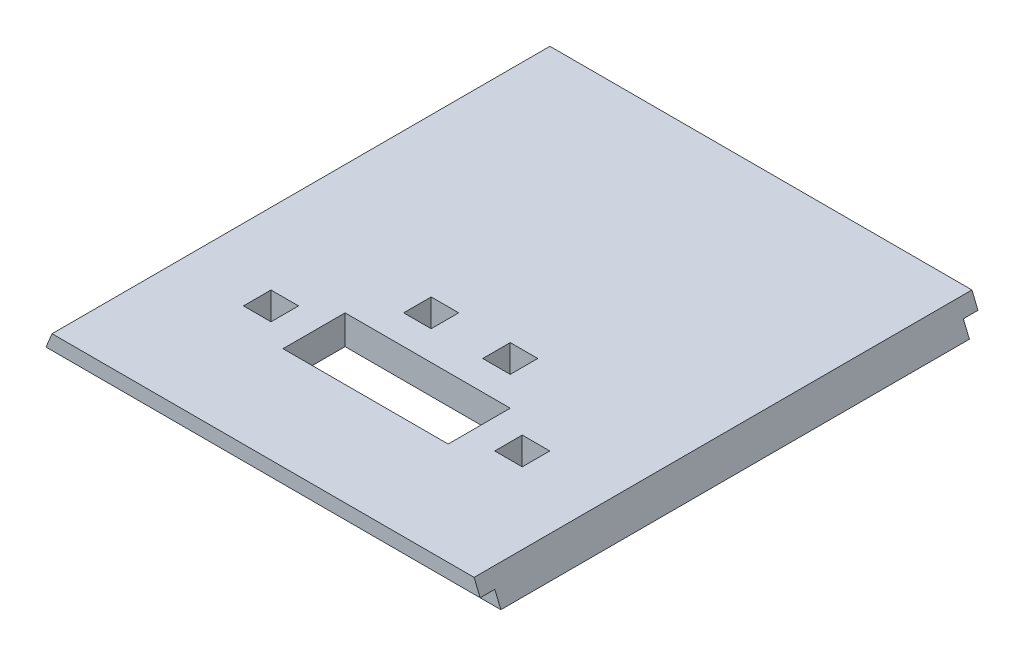
from build123d import *

# Parameters (mm, degrees)
BOSS_EXTRUDE1_DEPTH = 215.9
SKETCH2_W           = 193.548
SKETCH2_H           = 6.35
CUT_EXTRUDE1_DEPTH  = 6.35
SKETCH3_W           = 71.628
SKETCH3_H           = 26.924
SKETCH3_W_2         = 11.938
SKETCH3_H_2         = 11.938
CUT_EXTRUDE3_DEPTH  = 291.232541773


with BuildPart() as part:
    # Sketch1 → Boss-Extrude1 (new body)
    with BuildSketch(Plane.XY):
        Polygon((0, 0), (5.260512242, 12.7), (188.287487758, 12.7), (193.548, 0), align=None)
    extrude(amount=BOSS_EXTRUDE1_DEPTH)

    # Sketch2 → Cut-Extrude1 (cut)
    with BuildSketch(Plane.XZ):
        with Locations((96.774, 3.175)):
            Rectangle(SKETCH2_W, SKETCH2_H)
        with Locations((96.774, 212.725)):
            Rectangle(SKETCH2_W, SKETCH2_H)
    extrude(amount=-CUT_EXTRUDE1_DEPTH, mode=Mode.SUBTRACT)

    # Sketch3 → Cut-Extrude3 (cut, through all)
    with BuildSketch(Plane.XZ):
        with Locations((96.774, 157.988)):
            Rectangle(SKETCH3_W, SKETCH3_H)
        with Locations((79.629, 125.857)):
            Rectangle(SKETCH3_W_2, SKETCH3_H_2)
        with Locations((113.919, 125.857)):
            Rectangle(SKETCH3_W_2, SKETCH3_H_2)
        with Locations((151.257, 157.988)):
            Rectangle(SKETCH3_W_2, SKETCH3_H_2)
        with Locations((42.291, 157.988)):
            Rectangle(SKETCH3_W_2, SKETCH3_H_2)
    extrude(amount=-CUT_EXTRUDE3_DEPTH, mode=Mode.SUBTRACT)


solid = part.part
